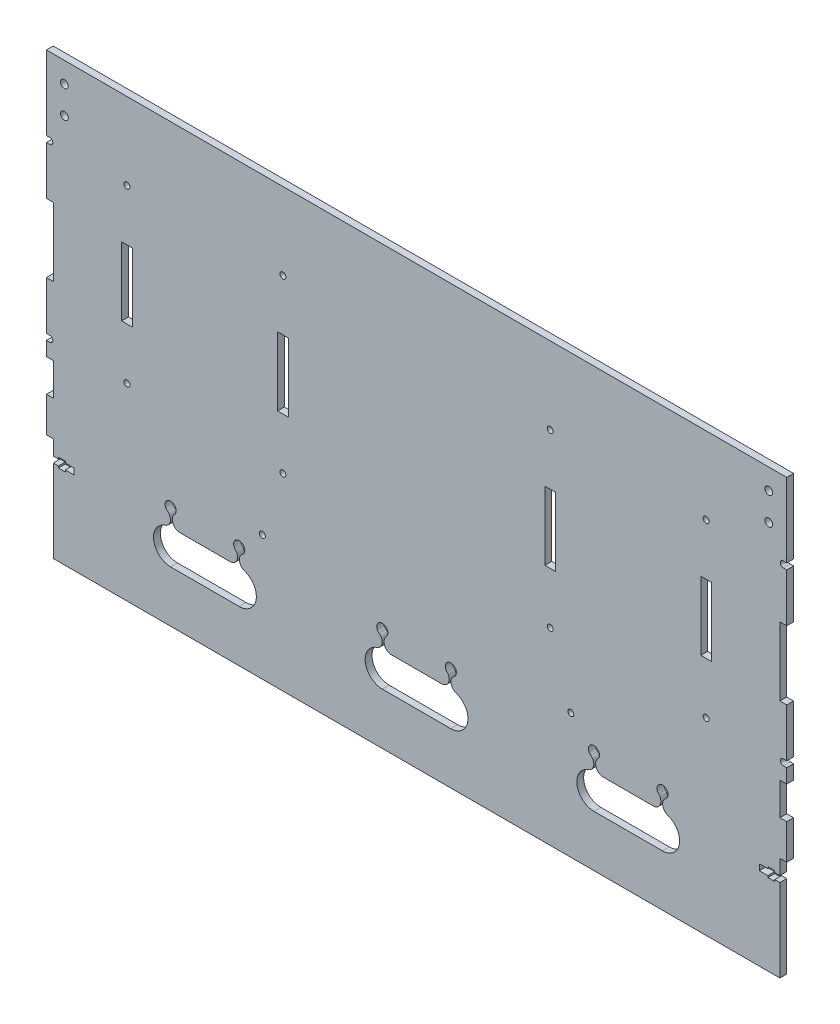
from build123d import *

# Parameters (mm, degrees)
SKETCH1_W          = 432
SKETCH1_H          = 255
BASE_FLANGE1_DEPTH = 4
SKETCH4_R          = 1.75
SKETCH4_W          = 4
SKETCH4_H          = 40
SKETCH4_W_2        = 6.3
CUT_EXTRUDE1_DEPTH = 251.855037821
CUT_EXTRUDE2_DEPTH = 251.855037821
SKETCH6_R          = 1.75
CUT_EXTRUDE3_DEPTH = 251.855037821
CUT_EXTRUDE4_REACH = 252.855
SKETCH7_R          = 2.25
SKETCH8_R          = 3.25
CUT_EXTRUDE5_DEPTH = 251.855037821
CUT_EXTRUDE6_DEPTH = 251.855037821
SKETCH10_W         = 4
SKETCH10_H         = 100
CUT_EXTRUDE7_DEPTH = 251.855037821
CUT_EXTRUDE8_DEPTH = 251.855037821
SKETCH13_W         = 4
SKETCH13_H         = 20.5
TAB1_DEPTH         = 4
CUT_EXTRUDE9_REACH = 252.855


# Sheet-metal steps are written as plain solids
with BuildPart() as part:
    # Sketch1 → Base-Flange1 (new body)
    with BuildSketch(Plane.XY):
        Rectangle(SKETCH1_W, SKETCH1_H)
    extrude(amount=-BASE_FLANGE1_DEPTH)

    # Sketch4 → Cut-Extrude1 (cut, through all)
    with BuildSketch(Plane.XY):
        with Locations((-78, 82.5)):
            Circle(SKETCH4_R)
        with Locations(Location((214, -17.5, 0), (0, 0, 180))):
            Circle(SKETCH4_R)
        with Locations(Location((214, 82.5, 0), (0, 0, 180))):
            Circle(SKETCH4_R)
        with Locations((-78, -17.5)):
            Circle(SKETCH4_R)
        with Locations((-169, -17.5)):
            Circle(SKETCH4_R)
        with Locations((-169, 82.5)):
            Circle(SKETCH4_R)
        with Locations((-214, 82.5)):
            Circle(SKETCH4_R)
        with Locations((-214, -17.5)):
            Circle(SKETCH4_R)
        with Locations(Location((169, 82.5, 0), (0, 0, 180))):
            Circle(SKETCH4_R)
        with Locations(Location((169, -17.5, 0), (0, 0, 180))):
            Circle(SKETCH4_R)
        with Locations(Location((78, -17.5, 0), (0, 0, 180))):
            Circle(SKETCH4_R)
        with Locations(Location((78, 82.5, 0), (0, 0, 180))):
            Circle(SKETCH4_R)
        with Locations((-214, 32.5)):
            Rectangle(SKETCH4_W, SKETCH4_H)
        with Locations((-169, 32.5)):
            Rectangle(SKETCH4_W_2, SKETCH4_H)
        with Locations((-78, 32.5)):
            Rectangle(SKETCH4_W_2, SKETCH4_H)
        with Locations((78, 32.5)):
            Rectangle(SKETCH4_W_2, SKETCH4_H)
        with Locations((169, 32.5)):
            Rectangle(SKETCH4_W_2, SKETCH4_H)
        with Locations((214, 32.5)):
            Rectangle(SKETCH4_W, SKETCH4_H)
    extrude(amount=-CUT_EXTRUDE1_DEPTH, mode=Mode.SUBTRACT)

    # Sketch5 → Cut-Extrude2 (cut, through all)
    with BuildSketch(Plane.XY):
        with BuildLine():
            Line((-214, 80.75), (-216, 80.75))
            ThreePointArc((-216, 80.75), (-217.75, 82.5), (-216, 84.25))
            Line((-216, 84.25), (-214, 84.25))
            ThreePointArc((-214, 84.25), (-212.25, 82.5), (-214, 80.75))
        make_face()
        with BuildLine():
            Line((-214, -19.25), (-216, -19.25))
            ThreePointArc((-216, -19.25), (-217.75, -17.5), (-216, -15.75))
            Line((-216, -15.75), (-214, -15.75))
            ThreePointArc((-214, -15.75), (-212.25, -17.5), (-214, -19.25))
        make_face()
        with BuildLine():
            Line((214, 80.75), (216, 80.75))
            ThreePointArc((216, 80.75), (217.75, 82.5), (216, 84.25))
            Line((216, 84.25), (214, 84.25))
            ThreePointArc((214, 84.25), (212.25, 82.5), (214, 80.75))
        make_face()
        with BuildLine():
            Line((214, -19.25), (216, -19.25))
            ThreePointArc((216, -19.25), (217.75, -17.5), (216, -15.75))
            Line((216, -15.75), (214, -15.75))
            ThreePointArc((214, -15.75), (212.25, -17.5), (214, -19.25))
        make_face()
    extrude(amount=-CUT_EXTRUDE2_DEPTH, mode=Mode.SUBTRACT)

    # Sketch6 → Cut-Extrude3 (cut, through all)
    with BuildSketch(Plane.XY):
        with Locations((-90, -54.5)):
            Circle(SKETCH6_R)
        with Locations((90, -54.5)):
            Circle(SKETCH6_R)
    extrude(amount=-CUT_EXTRUDE3_DEPTH, mode=Mode.SUBTRACT)

    # Sketch7 → Cut-Extrude4 (cut, up to next)
    with BuildSketch(Plane.XY, mode=Mode.PRIVATE) as cut_extrude4_sk1:
        with Locations((205.5, 115.5)):
            Circle(SKETCH7_R)
    cut_extrude4_tool1 = extrude(cut_extrude4_sk1.sketch, amount=-CUT_EXTRUDE4_REACH, mode=Mode.PRIVATE) & part.part
    # Sketch7 → Cut-Extrude4 (cut, up to next)
    with BuildSketch(Plane.XY, mode=Mode.PRIVATE) as cut_extrude4_sk2:
        with Locations((205.5, 99.5)):
            Circle(SKETCH7_R)
    cut_extrude4_tool2 = extrude(cut_extrude4_sk2.sketch, amount=-CUT_EXTRUDE4_REACH, mode=Mode.PRIVATE) & part.part
    # Sketch7 → Cut-Extrude4 (cut, up to next)
    with BuildSketch(Plane.XY, mode=Mode.PRIVATE) as cut_extrude4_sk3:
        with Locations((-205.5, 99.5)):
            Circle(SKETCH7_R)
    cut_extrude4_tool3 = extrude(cut_extrude4_sk3.sketch, amount=-CUT_EXTRUDE4_REACH, mode=Mode.PRIVATE) & part.part
    # Sketch7 → Cut-Extrude4 (cut, up to next)
    with BuildSketch(Plane.XY, mode=Mode.PRIVATE) as cut_extrude4_sk4:
        with Locations((-205.5, 115.5)):
            Circle(SKETCH7_R)
    cut_extrude4_tool4 = extrude(cut_extrude4_sk4.sketch, amount=-CUT_EXTRUDE4_REACH, mode=Mode.PRIVATE) & part.part
    add(cut_extrude4_tool1.solids().sort_by_distance((205.5, 115.5, 0))[0], mode=Mode.SUBTRACT)
    add(cut_extrude4_tool2.solids().sort_by_distance((205.5, 99.5, 0))[0], mode=Mode.SUBTRACT)
    add(cut_extrude4_tool3.solids().sort_by_distance((-205.5, 99.5, 0))[0], mode=Mode.SUBTRACT)
    add(cut_extrude4_tool4.solids().sort_by_distance((-205.5, 115.5, 0))[0], mode=Mode.SUBTRACT)

    # Sketch8 → Cut-Extrude5 (cut, through all)
    with BuildSketch(Plane.XY):
        with Locations((-143.5, -67.5)):
            Circle(SKETCH8_R)
        with Locations((-103.5, -67.5)):
            Circle(SKETCH8_R)
        with Locations((-20, -67.5)):
            Circle(SKETCH8_R)
        with Locations((20, -67.5)):
            Circle(SKETCH8_R)
        with Locations((103.5, -67.5)):
            Circle(SKETCH8_R)
        with Locations((143.5, -67.5)):
            Circle(SKETCH8_R)
    extrude(amount=-CUT_EXTRUDE5_DEPTH, mode=Mode.SUBTRACT)

    # Sketch9 → Cut-Extrude6 (cut, through all)
    with BuildSketch(Plane.XY):
        with BuildLine():
            Line((-143.5, -77.5), (-103.5, -77.5))
            ThreePointArc((-103.5, -77.5), (-93.5, -87.5), (-103.5, -97.5))
            Line((-103.5, -97.5), (-143.5, -97.5))
            ThreePointArc((-143.5, -97.5), (-153.5, -87.5), (-143.5, -77.5))
        make_face()
        with BuildLine():
            Line((-20, -77.5), (20, -77.5))
            ThreePointArc((20, -77.5), (30, -87.5), (20, -97.5))
            Line((20, -97.5), (-20, -97.5))
            ThreePointArc((-20, -97.5), (-30, -87.5), (-20, -77.5))
        make_face()
        with BuildLine():
            Line((143.5, -77.5), (103.5, -77.5))
            ThreePointArc((103.5, -77.5), (93.5, -87.5), (103.5, -97.5))
            Line((103.5, -97.5), (143.5, -97.5))
            ThreePointArc((143.5, -97.5), (153.5, -87.5), (143.5, -77.5))
        make_face()
    extrude(amount=-CUT_EXTRUDE6_DEPTH, mode=Mode.SUBTRACT)

    # Sketch10 → Cut-Extrude7 (cut, through all)
    with BuildSketch(Plane.XY):
        with Locations((-214, -77.5)):
            Rectangle(SKETCH10_W, SKETCH10_H)
        with Locations((214, -77.5)):
            Rectangle(SKETCH10_W, SKETCH10_H)
    extrude(amount=-CUT_EXTRUDE7_DEPTH, mode=Mode.SUBTRACT)

    # Sketch11 → Cut-Extrude8 (cut, through all)
    with BuildSketch(Plane.XY):
        Polygon((-212, -75.75), (-209, -75.75), (-209, -74.75), (-205, -74.75), (-205, -75.75), (-200, -75.75), (-200, -79.25), (-205, -79.25), (-205, -80.25), (-209, -80.25), (-209, -79.25), (-212, -79.25), align=None)
        Polygon((212, -79.25), (212, -75.75), (209, -75.75), (209, -74.75), (205, -74.75), (205, -75.75), (200, -75.75), (200, -79.25), (205, -79.25), (205, -80.25), (209, -80.25), (209, -79.25), align=None)
    extrude(amount=-CUT_EXTRUDE8_DEPTH, mode=Mode.SUBTRACT)

    # Sketch13 → Tab1 (add)
    with BuildSketch(Plane.XY):
        with Locations((-214, -56.75)):
            Rectangle(SKETCH13_W, SKETCH13_H)
        with Locations((214, -56.75)):
            Rectangle(SKETCH13_W, SKETCH13_H)
    extrude(amount=-TAB1_DEPTH)

    # Sketch14 → Cut-Extrude9 (cut, up to next)
    with BuildSketch(Plane.XY, mode=Mode.PRIVATE) as cut_extrude9_sk1:
        with BuildLine():
            Line((-145.424403398, -70.119002016), (-141.210288019, -69.806451613))
            ThreePointArc((-141.210288019, -69.806451613), (-142.200504545, -74.714501715), (-138.039917583, -77.5))
            Line((-138.039917583, -77.5), (-146.664801345, -78.014008621))
            ThreePointArc((-146.664801345, -78.014008621), (-143.64349365, -74.443747603), (-145.424403398, -70.119002016))
        make_face()
    cut_extrude9_tool1 = extrude(cut_extrude9_sk1.sketch, amount=-CUT_EXTRUDE9_REACH, mode=Mode.PRIVATE) & part.part
    # Sketch14 → Cut-Extrude9 (cut, up to next)
    with BuildSketch(Plane.XY, mode=Mode.PRIVATE) as cut_extrude9_sk2:
        with BuildLine():
            Line((-105.789711981, -69.806451613), (-101.575596602, -70.119002016))
            ThreePointArc((-101.575596602, -70.119002016), (-103.35650635, -74.443747603), (-100.335198655, -78.014008621))
            Line((-100.335198655, -78.014008621), (-108.960082417, -77.5))
            ThreePointArc((-108.960082417, -77.5), (-104.799495455, -74.714501715), (-105.789711981, -69.806451613))
        make_face()
    cut_extrude9_tool2 = extrude(cut_extrude9_sk2.sketch, amount=-CUT_EXTRUDE9_REACH, mode=Mode.PRIVATE) & part.part
    # Sketch14 → Cut-Extrude9 (cut, up to next)
    with BuildSketch(Plane.XY, mode=Mode.PRIVATE) as cut_extrude9_sk3:
        with BuildLine():
            Line((-21.924403398, -70.119002016), (-17.710288019, -69.806451613))
            ThreePointArc((-17.710288019, -69.806451613), (-18.700504545, -74.714501715), (-14.539917583, -77.5))
            Line((-14.539917583, -77.5), (-23.164801345, -78.014008621))
            ThreePointArc((-23.164801345, -78.014008621), (-20.14349365, -74.443747603), (-21.924403398, -70.119002016))
        make_face()
    cut_extrude9_tool3 = extrude(cut_extrude9_sk3.sketch, amount=-CUT_EXTRUDE9_REACH, mode=Mode.PRIVATE) & part.part
    # Sketch14 → Cut-Extrude9 (cut, up to next)
    with BuildSketch(Plane.XY, mode=Mode.PRIVATE) as cut_extrude9_sk4:
        with BuildLine():
            Line((17.710288019, -69.806451613), (21.924403398, -70.119002016))
            ThreePointArc((21.924403398, -70.119002016), (20.14349365, -74.443747603), (23.164801345, -78.014008621))
            Line((23.164801345, -78.014008621), (14.539917583, -77.5))
            ThreePointArc((14.539917583, -77.5), (18.700504545, -74.714501715), (17.710288019, -69.806451613))
        make_face()
    cut_extrude9_tool4 = extrude(cut_extrude9_sk4.sketch, amount=-CUT_EXTRUDE9_REACH, mode=Mode.PRIVATE) & part.part
    # Sketch14 → Cut-Extrude9 (cut, up to next)
    with BuildSketch(Plane.XY, mode=Mode.PRIVATE) as cut_extrude9_sk5:
        with BuildLine():
            Line((101.575596602, -70.119002016), (105.789711981, -69.806451613))
            ThreePointArc((105.789711981, -69.806451613), (104.799495455, -74.714501715), (108.960082417, -77.5))
            Line((108.960082417, -77.5), (100.335198655, -78.014008621))
            ThreePointArc((100.335198655, -78.014008621), (103.35650635, -74.443747603), (101.575596602, -70.119002016))
        make_face()
    cut_extrude9_tool5 = extrude(cut_extrude9_sk5.sketch, amount=-CUT_EXTRUDE9_REACH, mode=Mode.PRIVATE) & part.part
    # Sketch14 → Cut-Extrude9 (cut, up to next)
    with BuildSketch(Plane.XY, mode=Mode.PRIVATE) as cut_extrude9_sk6:
        with BuildLine():
            Line((141.210288019, -69.806451613), (145.424403398, -70.119002016))
            ThreePointArc((145.424403398, -70.119002016), (143.64349365, -74.443747603), (146.664801345, -78.014008621))
            Line((146.664801345, -78.014008621), (138.039917583, -77.5))
            ThreePointArc((138.039917583, -77.5), (142.200504545, -74.714501715), (141.210288019, -69.806451613))
        make_face()
    cut_extrude9_tool6 = extrude(cut_extrude9_sk6.sketch, amount=-CUT_EXTRUDE9_REACH, mode=Mode.PRIVATE) & part.part
    add(cut_extrude9_tool1.solids().sort_by_distance((-142.940406, -74.543394, 0))[0], mode=Mode.SUBTRACT)
    add(cut_extrude9_tool2.solids().sort_by_distance((-104.059594, -74.543394, 0))[0], mode=Mode.SUBTRACT)
    add(cut_extrude9_tool3.solids().sort_by_distance((-19.440406, -74.543394, 0))[0], mode=Mode.SUBTRACT)
    add(cut_extrude9_tool4.solids().sort_by_distance((19.440406, -74.543394, 0))[0], mode=Mode.SUBTRACT)
    add(cut_extrude9_tool5.solids().sort_by_distance((104.059594, -74.543394, 0))[0], mode=Mode.SUBTRACT)
    add(cut_extrude9_tool6.solids().sort_by_distance((142.940406, -74.543394, 0))[0], mode=Mode.SUBTRACT)


solid = part.part
